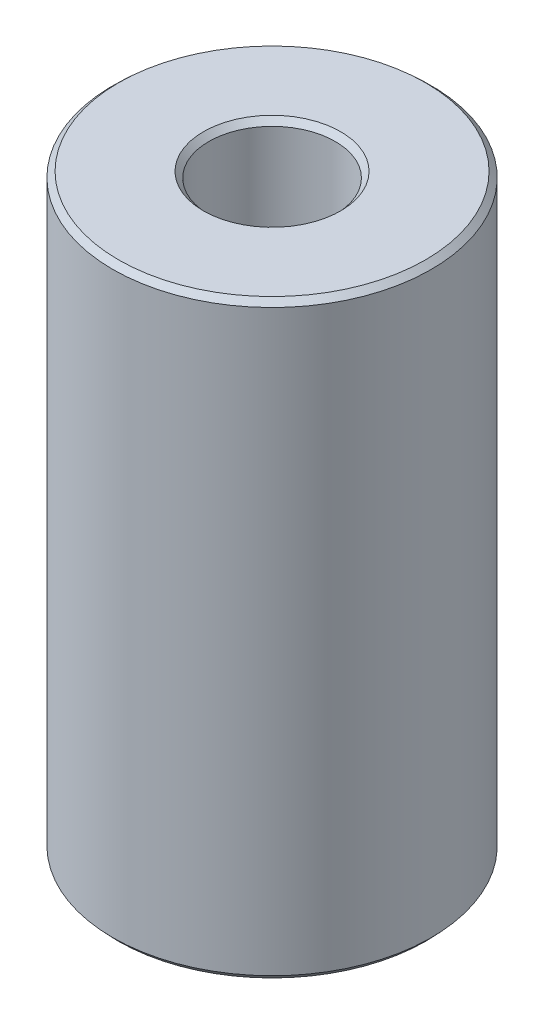
from build123d import *
from OCP.BRepFilletAPI import BRepFilletAPI_MakeChamfer

# Parameters (mm, degrees)
SKETCH1_R           = 15
BOSS_EXTRUDE1_DEPTH = 55.572769516
SKETCH2_R           = 5.956246178
CUT_EXTRUDE1_DEPTH  = 60.483886151
CHAMFER1_SIZE       = 0.509232301
CHAMFER1_SIZE2      = 0.543249398


with BuildPart() as part:
    # Sketch1 → Boss-Extrude1 (new body)
    with BuildSketch(Plane(origin=(0, 0, 0), x_dir=(1, 0, 0), z_dir=(0, 1, 0))):
        Circle(SKETCH1_R)
    extrude(amount=BOSS_EXTRUDE1_DEPTH)

    # Sketch2 → Cut-Extrude1 (cut, through all)
    with BuildSketch(Plane(origin=(0, 0, 0), x_dir=(1, 0, 0), z_dir=(0, 1, 0))):
        Circle(SKETCH2_R)
    extrude(amount=CUT_EXTRUDE1_DEPTH, mode=Mode.SUBTRACT)

    # Chamfer1: one chamfer whose edges measure the first distance from different faces: ONE call of the kernel's chamfer builder (chamfer() names one face for all edges)
    chamfer1_edges_1 = [part.edges().sort_by_distance(p)[0] for p in [
        (-5.956246178, 55.572769516, 0),
    ]]
    chamfer1_side_1 = [part.faces().sort_by_distance(p)[0] for p in [
        (-14.575735931, 55.572769516, 0),
    ]]
    chamfer1_edges_2 = [part.edges().sort_by_distance(p)[0] for p in [
        (-5.956246178, 0, 0),
    ]]
    chamfer1_side_2 = [part.faces().sort_by_distance(p)[0] for p in [
        (-5.956246178, 27.786384758, 0),
    ]]
    chamfer1_edges_3 = [part.edges().sort_by_distance(p)[0] for p in [
        (-15, 0, 0),
    ]]
    chamfer1_side_3 = [part.faces().sort_by_distance(p)[0] for p in [
        (-14.575735931, 0, 0),
    ]]
    chamfer1_edges_4 = [part.edges().sort_by_distance(p)[0] for p in [
        (-15, 55.572769516, 0),
    ]]
    chamfer1_side_4 = [part.faces().sort_by_distance(p)[0] for p in [
        (-15, 27.786384758, 0),
    ]]
    chamfer1 = BRepFilletAPI_MakeChamfer(part.part.solid().wrapped)
    for e in chamfer1_edges_1:
        chamfer1.Add(CHAMFER1_SIZE, CHAMFER1_SIZE2, e.wrapped, chamfer1_side_1[0].wrapped)  # the first distance lies on this face
    for e in chamfer1_edges_2:
        chamfer1.Add(CHAMFER1_SIZE, CHAMFER1_SIZE2, e.wrapped, chamfer1_side_2[0].wrapped)  # the first distance lies on this face
    for e in chamfer1_edges_3:
        chamfer1.Add(CHAMFER1_SIZE, CHAMFER1_SIZE2, e.wrapped, chamfer1_side_3[0].wrapped)  # the first distance lies on this face
    for e in chamfer1_edges_4:
        chamfer1.Add(CHAMFER1_SIZE, CHAMFER1_SIZE2, e.wrapped, chamfer1_side_4[0].wrapped)  # the first distance lies on this face
    add(Compound.cast(chamfer1.Shape()), mode=Mode.REPLACE)


solid = part.part
